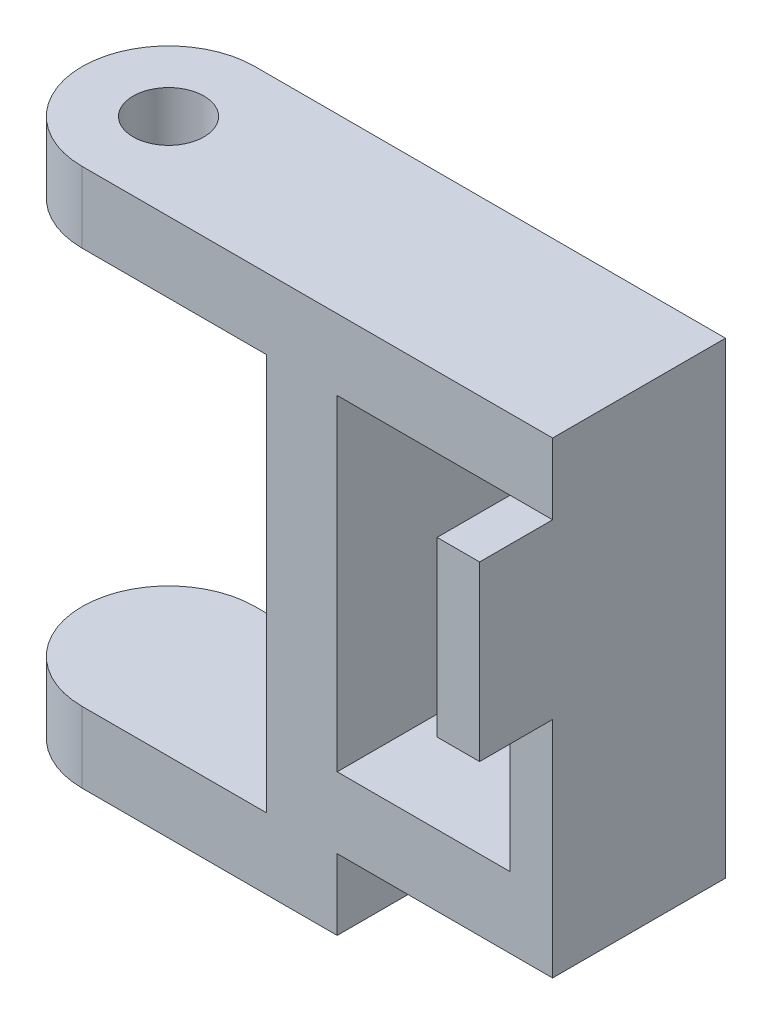
from build123d import *

# Parameters (mm, degrees)
BOSS_EXTRUDE1_DEPTH = 12.2
SKETCH4_R           = 2.5
CUT_EXTRUDE1_DEPTH  = 5
CUT_EXTRUDE2_START  = -38
CUT_EXTRUDE2_DEPTH  = 38
SKETCH6_R           = 2
BOSS_EXTRUDE2_DEPTH = 3
SKETCH7_W           = 12.2
SKETCH7_H           = 4.999065242
SKETCH7_H_2         = 5
BOSS_EXTRUDE3_DEPTH = 15.2
BOSS_EXTRUDE5_REACH = 57.477
SKETCH9_W           = 3
SKETCH9_H           = 12.2
SKETCH10_W          = 3
SKETCH10_H          = 12.2
BOSS_EXTRUDE6_DEPTH = 5.15


# Read off the part's stored shape, not the designer's step: Cut-Extrude2
with BuildPart() as part:
    # Sketch3 → Boss-Extrude1 (new body)
    with BuildSketch(Plane.XY):
        Polygon((-40.407881927, 21.413178882), (-21.307881927, 21.413178882), (-21.307881927, -6.586821118), (-40.407881927, -6.586821118), (-40.407881927, -11.586821118), (-16.307881927, -11.586821118), (-16.307881927, 26.413178882), (-40.407881927, 26.413178882), align=None)
    extrude(amount=BOSS_EXTRUDE1_DEPTH)

    # Sketch4 → Cut-Extrude1 (cut)
    with BuildSketch(Plane(origin=(0, 26.413178882, 0), x_dir=(1, 0, 0), z_dir=(0, 1, 0))):
        with Locations(Location((-34.307881927, -6.1, 0), (0, 0, 270))):
            Circle(SKETCH4_R)
    extrude(amount=-CUT_EXTRUDE1_DEPTH, mode=Mode.SUBTRACT)

    # Cut-Extrude2 outline → Cut-Extrude2 (cut)
    with BuildSketch(Plane(origin=(0, 26.413178882, 0), x_dir=(1, 0, 0), z_dir=(0, 1, 0)).offset(CUT_EXTRUDE2_START)):
        with BuildLine():
            Line((-40.407881927, -12.2), (-34.307881927, -12.2))
            ThreePointArc((-34.307881927, -12.2), (-38.621233292, -10.413351365), (-40.407881927, -6.1))
            Line((-40.407881927, -6.1), (-40.407881927, -12.2))
        make_face()
        with BuildLine():
            Line((-40.407881927, 0), (-40.407881927, -6.1))
            ThreePointArc((-40.407881927, -6.1), (-38.621233292, -1.786648635), (-34.307881927, 0))
            Line((-34.307881927, 0), (-40.407881927, 0))
        make_face()
    extrude(amount=CUT_EXTRUDE2_DEPTH, mode=Mode.SUBTRACT)

    # Sketch6 → Boss-Extrude2 (add)
    with BuildSketch(Plane.XZ.offset(11.586821118)):
        with Locations(Location((-34.307881927, 6.1, 0), (0, 0, 180))):
            Circle(SKETCH6_R)
    extrude(amount=BOSS_EXTRUDE2_DEPTH)

    # Sketch7 → Boss-Extrude3 (add)
    with BuildSketch(Plane(origin=(-16.307881927, 0, 0), x_dir=(0, 0, -1), z_dir=(1, 0, 0))):
        with Locations((-6.1, 23.913646261)):
            Rectangle(SKETCH7_W, SKETCH7_H)
        with Locations((-6.1, -4.086821118)):
            Rectangle(SKETCH7_W, SKETCH7_H_2)
    extrude(amount=BOSS_EXTRUDE3_DEPTH)

    # Sketch9 → Boss-Extrude5 (add, up to next)
    with BuildSketch(Plane.XZ.offset(-21.41411364), mode=Mode.PRIVATE) as boss_extrude5_sk1:
        with Locations((-2.607881927, 6.1)):
            Rectangle(SKETCH9_W, SKETCH9_H)
    boss_extrude5_tool1 = extrude(boss_extrude5_sk1.sketch, amount=BOSS_EXTRUDE5_REACH, mode=Mode.PRIVATE) - part.part
    add(boss_extrude5_tool1.solids().sort_by_distance((-2.607882, 21.414114, 6.1))[0])

    # Sketch10 → Boss-Extrude6 (add)
    with BuildSketch(Plane.XY.offset(12.2)):
        with Locations((-2.607881927, 15.31411364)):
            Rectangle(SKETCH10_W, SKETCH10_H)
    extrude(amount=BOSS_EXTRUDE6_DEPTH)


solid = part.part
